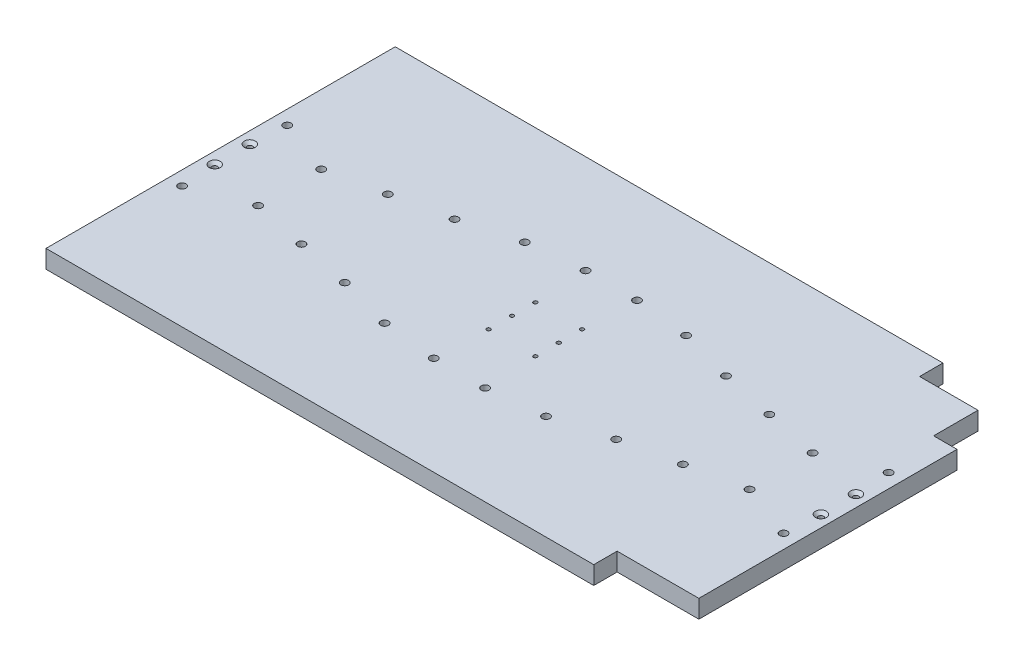
from build123d import *

# Parameters (mm, degrees)
SKETCH1_W                                     = 539
SKETCH1_H                                     = 299
BOSS_EXTRUDE1_DEPTH                           = 15.5
SKETCH22_W                                    = 70
SKETCH22_H                                    = 20
CUT_EXTRUDE9_DEPTH                            = 309.578596147
CSK_FOR_M4_COUNTERSUNK_FLAT_HEAD1_D           = 4.5
CSK_FOR_M4_COUNTERSUNK_FLAT_HEAD1_CSINK_D     = 9.4
CSK_FOR_M4_COUNTERSUNK_FLAT_HEAD1_CSINK_ANGLE = 90
MIRROR2_COPY_1_D                              = 4.5
MIRROR2_COPY_1_CSINK_D                        = 9.4
MIRROR2_COPY_1_CSINK_ANGLE                    = 90
SKETCH23_W                                    = 200
SKETCH23_H                                    = 60
CUT_EXTRUDE10_DEPTH                           = 11.5
SKETCH24_R                                    = 10.5
CUT_EXTRUDE11_DEPTH                           = 15
BOSS_EXTRUDE2_REACH                           = 326.177
SKETCH25_R                                    = 10.5
SKETCH26_R                                    = 10.5
CUT_EXTRUDE12_DEPTH                           = 10
CUT_EXTRUDE13_DEPTH                           = 6
MIRROR15_COPY_1_SKETCH_R                      = 10.5
MIRROR15_COPY_1_DEPTH                         = 10
M6_CLEARANCE_HOLE1_D                          = 6.6
MIRROR17_COPY_1_D                             = 6.6
M4X0_7_TAPPED_HOLE1_D                         = 3.3


with BuildPart() as part:
    # Sketch1 → Boss-Extrude1 (new body)
    with BuildSketch(Plane(origin=(0, 0, 0), x_dir=(1, 0, 0), z_dir=(0, 1, 0))):
        Rectangle(SKETCH1_W, SKETCH1_H)
    extrude(amount=-BOSS_EXTRUDE1_DEPTH)

    # Sketch22 → Cut-Extrude9 (cut, through all)
    with BuildSketch(Plane(origin=(0, 0, 0), x_dir=(1, 0, 0), z_dir=(0, 1, 0))):
        Polygon((269.5, 149.5), (199.5, 149.5), (199.5, 129.5), (249.5, 129.5), (249.5, 91.5), (269.5, 91.5), align=None)
        with Locations((234.5, -139.5)):
            Rectangle(SKETCH22_W, SKETCH22_H)
    extrude(amount=-CUT_EXTRUDE9_DEPTH, mode=Mode.SUBTRACT)

    # CSK for M4 Countersunk Flat Head1 (through all)
    with Locations(Plane(origin=(-259.5, 0, -15), x_dir=(0, 0, 1), z_dir=(0, 1, 0))):
        with Locations((0, 0)):
            csk_for_m4_countersunk_flat_head1 = CounterSinkHole(CSK_FOR_M4_COUNTERSUNK_FLAT_HEAD1_D / 2, CSK_FOR_M4_COUNTERSUNK_FLAT_HEAD1_CSINK_D / 2, counter_sink_angle=CSK_FOR_M4_COUNTERSUNK_FLAT_HEAD1_CSINK_ANGLE)

    # Mirror1: CSK for M4 Countersunk Flat Head1 across plane
    add(csk_for_m4_countersunk_flat_head1.mirror(Plane.XY), mode=Mode.SUBTRACT)

    # Mirror2: CSK for M4 Countersunk Flat Head1 across plane
    add(csk_for_m4_countersunk_flat_head1.mirror(Plane(origin=(0, 0, 0), x_dir=(0, 0, 1), z_dir=(1, 0, 0))), mode=Mode.SUBTRACT)

    # Mirror2 copy 1 (through all)
    with Locations(Plane(origin=(259.5, 0, 15), x_dir=(0, 0, -1), z_dir=(0, 1, 0))):
        with Locations((0, 0)):
            CounterSinkHole(MIRROR2_COPY_1_D / 2, MIRROR2_COPY_1_CSINK_D / 2, counter_sink_angle=MIRROR2_COPY_1_CSINK_ANGLE)

    # Sketch23 → Cut-Extrude10 (cut)
    with BuildSketch(Plane.XZ.offset(15.5)):
        Rectangle(SKETCH23_W, SKETCH23_H)
    extrude(amount=-CUT_EXTRUDE10_DEPTH, mode=Mode.SUBTRACT)

    # Sketch24 → Cut-Extrude11 (cut)
    with BuildSketch(Plane(origin=(0, 0, 30), x_dir=(-1, 0, 0), z_dir=(0, 0, -1))):
        with Locations((0, -15.5)):
            Circle(SKETCH24_R)
    cut_extrude11 = extrude(amount=-CUT_EXTRUDE11_DEPTH, mode=Mode.SUBTRACT)

    # Mirror3: Cut-Extrude11 across plane
    add(cut_extrude11.mirror(Plane.XY), mode=Mode.SUBTRACT)

    # Sketch25 → Boss-Extrude2 (add, up to next)
    with BuildSketch(Plane(origin=(0, 0, 30), x_dir=(-1, 0, 0), z_dir=(0, 0, -1)), mode=Mode.PRIVATE) as boss_extrude2_sk1:
        with Locations((-20, -4)):
            Circle(SKETCH25_R)
    boss_extrude2_tool1 = extrude(boss_extrude2_sk1.sketch, amount=BOSS_EXTRUDE2_REACH, mode=Mode.PRIVATE) - part.part
    # Sketch25 → Boss-Extrude2 (add, up to next)
    with BuildSketch(Plane(origin=(0, 0, 30), x_dir=(-1, 0, 0), z_dir=(0, 0, -1)), mode=Mode.PRIVATE) as boss_extrude2_sk2:
        with Locations((-60, -4)):
            Circle(SKETCH25_R)
    boss_extrude2_tool2 = extrude(boss_extrude2_sk2.sketch, amount=BOSS_EXTRUDE2_REACH, mode=Mode.PRIVATE) - part.part
    # Sketch25 → Boss-Extrude2 (add, up to next)
    with BuildSketch(Plane(origin=(0, 0, 30), x_dir=(-1, 0, 0), z_dir=(0, 0, -1)), mode=Mode.PRIVATE) as boss_extrude2_sk3:
        with Locations((-100, -4)):
            Circle(SKETCH25_R)
    boss_extrude2_tool3 = extrude(boss_extrude2_sk3.sketch, amount=BOSS_EXTRUDE2_REACH, mode=Mode.PRIVATE) - part.part
    boss_extrude2_1 = boss_extrude2_tool1.solids().sort_by_distance((20, -4, 30))[0]
    add(boss_extrude2_1)
    boss_extrude2_2 = boss_extrude2_tool2.solids().sort_by_distance((60, -4, 30))[0]
    add(boss_extrude2_2)
    boss_extrude2_3 = boss_extrude2_tool3.solids().sort_by_distance((100, -4, 30))[0]
    add(boss_extrude2_3)
    boss_extrude2 = boss_extrude2_1 + boss_extrude2_2 + boss_extrude2_3  # Boss-Extrude2 as one shape, for the pattern or mirror that repeats it

    # Sketch26 → Cut-Extrude12 (cut)
    with BuildSketch(Plane.XY.offset(-30)):
        with Locations((40, -15.5)):
            Circle(SKETCH26_R)
        with Locations((80, -15.5)):
            Circle(SKETCH26_R)
    cut_extrude12 = extrude(amount=-CUT_EXTRUDE12_DEPTH, mode=Mode.SUBTRACT)

    # Mirror4: Boss-Extrude2 across plane
    add(boss_extrude2.mirror(Plane(origin=(0, 0, 0), x_dir=(0, 0, 1), z_dir=(1, 0, 0))))

    # Sketch27 → Cut-Extrude13 (cut)
    with BuildSketch(Plane.XZ.offset(15.5)):
        with BuildLine():
            Line((-260, -3), (-227.025012956, -3))
            Line((-227.025012956, -3), (-227.025012956, 3))
            Line((-227.025012956, 3), (-260, 3))
            ThreePointArc((-260, 3), (-263, 0), (-260, -3))
        make_face()
    cut_extrude13 = extrude(amount=-CUT_EXTRUDE13_DEPTH, mode=Mode.SUBTRACT)

    # Mirror14: Cut-Extrude12 across plane
    add(cut_extrude12.mirror(Plane.XY), mode=Mode.SUBTRACT)

    # Mirror15: Cut-Extrude12 across plane
    add(cut_extrude12.mirror(Plane(origin=(0, 0, 0), x_dir=(0, 0, 1), z_dir=(1, 0, 0))), mode=Mode.SUBTRACT)

    # Mirror15 copy 1 sketch → Mirror15 copy 1 (cut)
    with BuildSketch(Plane(origin=(0, 0, 30), x_dir=(-1, 0, 0), z_dir=(0, 0, -1))):
        with Locations((40, -15.5)):
            Circle(MIRROR15_COPY_1_SKETCH_R)
        with Locations((80, -15.5)):
            Circle(MIRROR15_COPY_1_SKETCH_R)
    extrude(amount=-MIRROR15_COPY_1_DEPTH, mode=Mode.SUBTRACT)

    # Cut-Loft1: read off the stored shape, not the designer's step
    # Cut-Loft1: loft between two sections, ruled curve by curve
    cut_loft1_from = [
        Edge.make_line((-100, -14.5, 30), (-100, -15.5, 30)),
        Edge.make_line((-100, -14.5, -30), (-100, -14.5, 30)),
        Edge.make_line((-100, -15.5, -30), (-100, -14.5, -30)),
        Edge.make_line((-100, -15.5, -30), (-100, -15.5, 30)),
    ]
    cut_loft1_to = [
        Edge.make_line((-227.025012956, -9.5, 3), (-227.025012956, -15.5, 3)),
        Edge.make_line((-227.025012956, -9.5, -3), (-227.025012956, -9.5, 3)),
        Edge.make_line((-227.025012956, -15.5, -3), (-227.025012956, -9.5, -3)),
        Edge.make_line((-227.025012956, -15.5, -3), (-227.025012956, -15.5, 3)),
    ]
    cut_loft1 = Solid(Shell([*[Face.make_surface_from_curves(cut_loft1_from[k], cut_loft1_to[k]) for k in range(4)], Face(Wire(cut_loft1_from)), Face(Wire(cut_loft1_to))]))
    add(cut_loft1, mode=Mode.SUBTRACT)

    # Mirror9: Cut-Extrude13 across plane
    add(cut_extrude13.mirror(Plane(origin=(0, 0, 0), x_dir=(0, 0, 1), z_dir=(1, 0, 0))), mode=Mode.SUBTRACT)

    # loft from a face of the part (cut_loft2)
    loft([part.faces().sort_by_distance((100, -15, 0))[0], part.faces().sort_by_distance((227.025012956, -12.5, 0))[0]], mode=Mode.SUBTRACT)

    # M6 Clearance Hole1 (through all)
    with Locations(Plane(origin=(-257.5, 0, 45), x_dir=(0, 0, 1), z_dir=(0, 1, 0))):
        with Locations((0, 0), (-18.019432511, 47.1), (-8.008018456, 94.2), (2.003395598, 141.3), (15, 188.4), (20, 235.5)):
            m6_clearance_hole1 = Hole(M6_CLEARANCE_HOLE1_D / 2)

    # Mirror16: M6 Clearance Hole1 across plane
    add(m6_clearance_hole1.mirror(Plane(origin=(0, 0, 0), x_dir=(0, 0, 1), z_dir=(1, 0, 0))), mode=Mode.SUBTRACT)

    # Mirror17: M6 Clearance Hole1 across plane
    add(m6_clearance_hole1.mirror(Plane.XY), mode=Mode.SUBTRACT)

    # Mirror17 copy 1 (through all)
    with Locations(Plane(origin=(257.5, 0, -45), x_dir=(0, 0, -1), z_dir=(0, 1, 0))):
        with Locations((0, 0), (-18.019432511, 47.1), (-8.008018456, 94.2), (2.003395598, 141.3), (15, 188.4), (20, 235.5)):
            Hole(MIRROR17_COPY_1_D / 2)

    # M4x0.7 Tapped Hole1 (through all)
    with Locations(Plane(origin=(20, 0, 20), x_dir=(0, 0, 1), z_dir=(0, 1, 0))):
        with Locations((0, 0), (0, -40), (-20, -40), (-40, -40), (-20, 0), (-40, 0)):
            Hole(M4X0_7_TAPPED_HOLE1_D / 2)


solid = part.part
